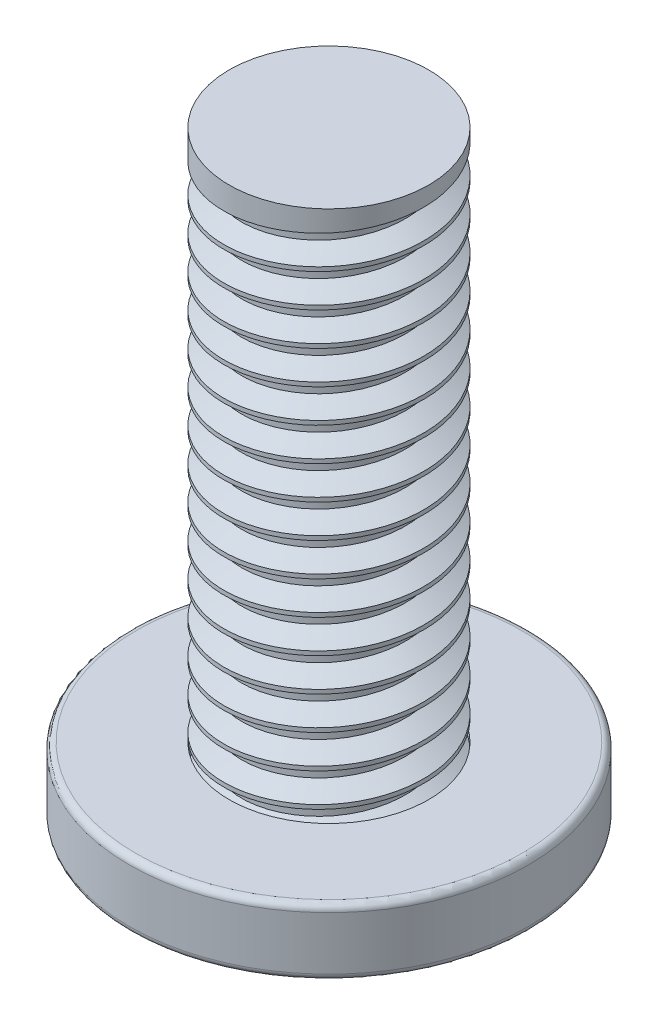
from build123d import *

# Parameters (mm, degrees)
SKETCH2_R           = 3
BOSS_EXTRUDE1_DEPTH = 1
SKETCH3_R           = 1.5
BOSS_EXTRUDE2_DEPTH = 8
THREAD1_PITCH       = 0.5
CUT_EXTRUDE1_DEPTH  = 0.5
FILLET1_R           = 0.1


with BuildPart() as part:
    # Sketch2 → Boss-Extrude1 (new body)
    with BuildSketch(Plane(origin=(0, 0, 0), x_dir=(1, 0, 0), z_dir=(0, 1, 0))):
        with Locations(Location((0, 0, 0), (0, 0, 270))):
            Circle(SKETCH2_R)
    extrude(amount=BOSS_EXTRUDE1_DEPTH)

    # Sketch3 → Boss-Extrude2 (add)
    with BuildSketch(Plane(origin=(0, 1, 0), x_dir=(1, 0, 0), z_dir=(0, 1, 0))):
        with Locations(Location((0, 0, 0), (0, 0, 270))):
            Circle(SKETCH3_R)
    extrude(amount=BOSS_EXTRUDE2_DEPTH)

    # Thread1: the profile of Thread Profile1 profile screwed along a right-hand helix of 16 turns, 6 arcs to a turn; built about Z, then put on its axis
    thread1_z = Axis((0, 0, 0), (0, 0, 1))
    thread1_corners = [(1.5003, 0, -0.000173205), (1.5003, 0, 0.437673204), (1.229367063, 0, 0.281249999), (1.229367063, 0, 0.156249999)]
    with BuildLine(mode=Mode.PRIVATE) as thread1_profile:
        Line(thread1_corners[0], thread1_corners[1])
        Line(thread1_corners[1], thread1_corners[2])
        Line(thread1_corners[2], thread1_corners[3])
        Line(thread1_corners[3], thread1_corners[0])
    thread1_cap = Face(thread1_profile.wire())
    thread1_turn_angles = [0, 30, 60, 90, 120, 150, 180, 210, 240, 270, 300, 330, 360]
    thread1_turn_weights = [1, 0.8660254037844387, 1, 0.8660254037844387, 1, 0.8660254037844387, 1, 0.8660254037844387, 1, 0.8660254037844387, 1, 0.8660254037844387, 1]
    thread1_turn_rails = [Edge.make_bspline([Vector(p[0], p[1], 0).rotate(thread1_z, thread1_turn_angles[k]) / thread1_turn_weights[k] + Vector(0, 0, p[2] + THREAD1_PITCH * thread1_turn_angles[k] / 360) for k in range(13)], [0, 0, 0, 1, 1, 2, 2, 3, 3, 4, 4, 5, 5, 6, 6, 6], 2, thread1_turn_weights) for p in thread1_corners]
    thread1_turn_sides = [Face.make_surface_from_curves(thread1_turn_rails[p[0]], thread1_turn_rails[p[1]]) for p in [(0, 1), (1, 2), (2, 3), (3, 0)]]
    thread1 = Plane(origin=(0, 9, 0), x_dir=(-1, 0, 0), z_dir=(0, -1, 0)) * Solid(Shell([*[p.moved(Location((0, 0, THREAD1_PITCH * i))) for i in range(16) for p in thread1_turn_sides], thread1_cap, thread1_cap.rotate(thread1_z, 5760).moved(Location((0, 0, THREAD1_PITCH * 5760 / 360)))]))
    add(thread1, mode=Mode.SUBTRACT)

    # Sketch13 → Cut-Extrude1 (cut)
    with BuildSketch(Plane.XZ):
        Polygon((1.154700538, 0), (0.577350269, 1), (-0.577350269, 1), (-1.154700538, 0), (-0.577350269, -1), (0.577350269, -1), align=None)
    extrude(amount=-CUT_EXTRUDE1_DEPTH, mode=Mode.SUBTRACT)

    # Fillet1
    fillet1_edges = [part.edges().sort_by_distance(p)[0] for p in [
        (0, 0, -3),
        (0, 1, -3),
    ]]
    fillet(fillet1_edges, radius=FILLET1_R)


solid = part.part
